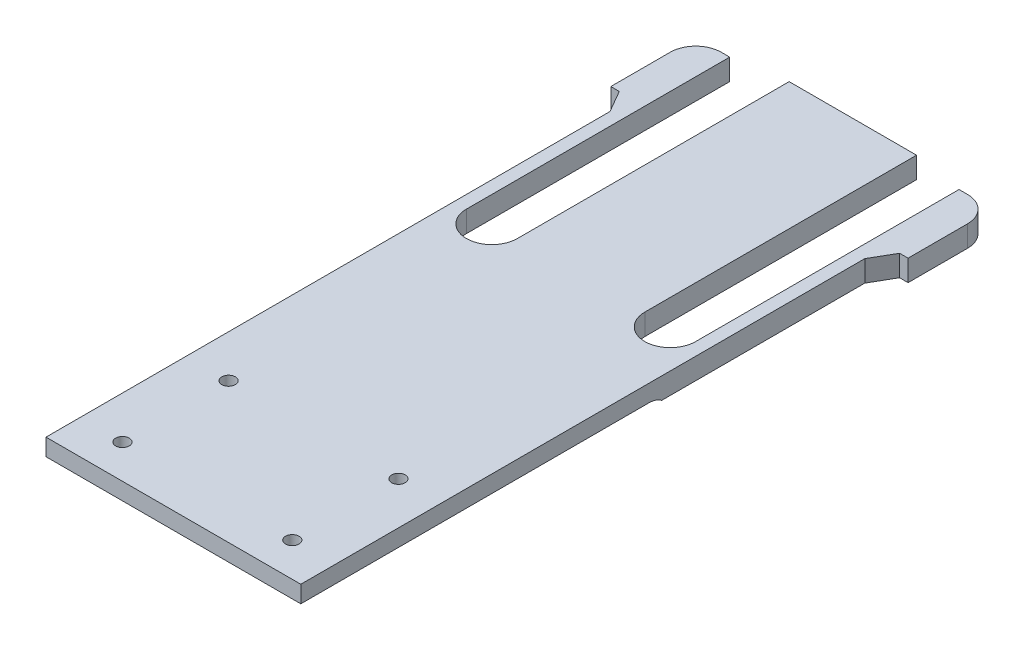
from build123d import *

# Parameters (mm, degrees)
BOSS_EXTRUDE1_DEPTH = 5
FILLET1_R           = 6
CHAMFER1_SIZE       = 3
CHAMFER1_SIZE2      = 5.196152423
CHAMFER2_SIZE       = 3
CHAMFER2_SIZE2      = 5.196152423
CUT_EXTRUDE1_REACH  = 165.86
SKETCH4_R           = 1.6
CUT_EXTRUDE2_REACH  = 174.772
SKETCH5_W           = 85
SKETCH5_H           = 1
FILLET3_R           = 5


# Some blends are built 0.0001 mm under size
with BuildPart() as part:
    # Sketch2 → Boss-Extrude1 (new body)
    with BuildSketch(Plane(origin=(0, 0, 0), x_dir=(1, 0, 0), z_dir=(0, 1, 0))):
        Polygon((15, 0), (-15, 0), (-15, -70), (-27, -70), (-27, -2), (-35, -2), (-35, -22), (-30, -22), (-30, -160), (30, -160), (30, -22), (35, -22), (35, -2), (27, -2), (27, -70), (15, -70), align=None)
    extrude(amount=BOSS_EXTRUDE1_DEPTH)

    # Fillet1
    fillet1_edges = [part.edges().sort_by_distance(p)[0] for p in [
        (-27, 2.5, 70),
        (-15, 2.5, 70),
        (15, 2.5, 70),
        (27, 2.5, 70),
        (-35, 2.5, 2),
        (35, 2.5, 2),
    ]]
    fillet(fillet1_edges, radius=FILLET1_R - 0.0001)  # a hair under: the kernel refuses the full size

    # Chamfer1
    chamfer1_edges = [part.edges().sort_by_distance(p)[0] for p in [
        (-30, 2.5, 22),
    ]]
    chamfer1_side = [part.faces().sort_by_distance(p)[0] for p in [
        (-32.5, 2.5, 22),
    ]]
    chamfer(chamfer1_edges, length=CHAMFER1_SIZE, length2=CHAMFER1_SIZE2, reference=chamfer1_side[0])

    # Chamfer2
    chamfer2_edges = [part.edges().sort_by_distance(p)[0] for p in [
        (30, 2.5, 22),
    ]]
    chamfer2_side = [part.faces().sort_by_distance(p)[0] for p in [
        (32.5, 2.5, 22),
    ]]
    chamfer(chamfer2_edges, length=CHAMFER2_SIZE, length2=CHAMFER2_SIZE2, reference=chamfer2_side[0])

    # Sketch4 → Cut-Extrude1 (cut, up to next)
    with BuildSketch(Plane(origin=(0, 5, 0), x_dir=(1, 0, 0), z_dir=(0, 1, 0)), mode=Mode.PRIVATE) as cut_extrude1_sk1:
        with Locations(Location((-20, -152, 0), (0, 0, 270))):
            Circle(SKETCH4_R)
    cut_extrude1_tool1 = extrude(cut_extrude1_sk1.sketch, amount=-CUT_EXTRUDE1_REACH, mode=Mode.PRIVATE) & part.part
    # Sketch4 → Cut-Extrude1 (cut, up to next)
    with BuildSketch(Plane(origin=(0, 5, 0), x_dir=(1, 0, 0), z_dir=(0, 1, 0)), mode=Mode.PRIVATE) as cut_extrude1_sk2:
        with Locations(Location((20, -152, 0), (0, 0, 270))):
            Circle(SKETCH4_R)
    cut_extrude1_tool2 = extrude(cut_extrude1_sk2.sketch, amount=-CUT_EXTRUDE1_REACH, mode=Mode.PRIVATE) & part.part
    # Sketch4 → Cut-Extrude1 (cut, up to next)
    with BuildSketch(Plane(origin=(0, 5, 0), x_dir=(1, 0, 0), z_dir=(0, 1, 0)), mode=Mode.PRIVATE) as cut_extrude1_sk3:
        with Locations(Location((-20, -127, 0), (0, 0, 270))):
            Circle(SKETCH4_R)
    cut_extrude1_tool3 = extrude(cut_extrude1_sk3.sketch, amount=-CUT_EXTRUDE1_REACH, mode=Mode.PRIVATE) & part.part
    # Sketch4 → Cut-Extrude1 (cut, up to next)
    with BuildSketch(Plane(origin=(0, 5, 0), x_dir=(1, 0, 0), z_dir=(0, 1, 0)), mode=Mode.PRIVATE) as cut_extrude1_sk4:
        with Locations(Location((20, -127, 0), (0, 0, 270))):
            Circle(SKETCH4_R)
    cut_extrude1_tool4 = extrude(cut_extrude1_sk4.sketch, amount=-CUT_EXTRUDE1_REACH, mode=Mode.PRIVATE) & part.part
    add(cut_extrude1_tool1.solids().sort_by_distance((-20, 5, 152))[0], mode=Mode.SUBTRACT)
    add(cut_extrude1_tool2.solids().sort_by_distance((20, 5, 152))[0], mode=Mode.SUBTRACT)
    add(cut_extrude1_tool3.solids().sort_by_distance((-20, 5, 127))[0], mode=Mode.SUBTRACT)
    add(cut_extrude1_tool4.solids().sort_by_distance((20, 5, 127))[0], mode=Mode.SUBTRACT)

    # Sketch5 → Cut-Extrude2 (cut, up to next)
    with BuildSketch(Plane.ZY.offset(30), mode=Mode.PRIVATE) as cut_extrude2_sk1:
        with Locations((117.5, 0.5)):
            Rectangle(SKETCH5_W, SKETCH5_H)
    cut_extrude2_tool1 = extrude(cut_extrude2_sk1.sketch, amount=-CUT_EXTRUDE2_REACH, mode=Mode.PRIVATE) & part.part
    add(cut_extrude2_tool1.solids().sort_by_distance((-30, 0.5, 117.5))[0], mode=Mode.SUBTRACT)

    # Fillet3
    # the kernel refuses this fillet: 5 mm, written as the material it adds along each edge
    with BuildSketch(Plane(origin=(-30, 1, 75), x_dir=(0, -1, 0), z_dir=(1, 0, 0))) as fillet3_piece_1:
        with BuildLine():
            CenterArc((5, -3), FILLET3_R, 143.130102354, 36.869897646)
            Line((0, -3), (-0.1, -3))
            Line((-0.1, -3), (-0.1, 0))
            Line((-0.1, 0), (0, 0.1))
            ThreePointArc((0, 0.1), (0.5, 0.1), (0.92, 0.06))
            Line((0.92, 0.06), (1, 0))
        make_face()
    extrude(amount=60)


solid = part.part
